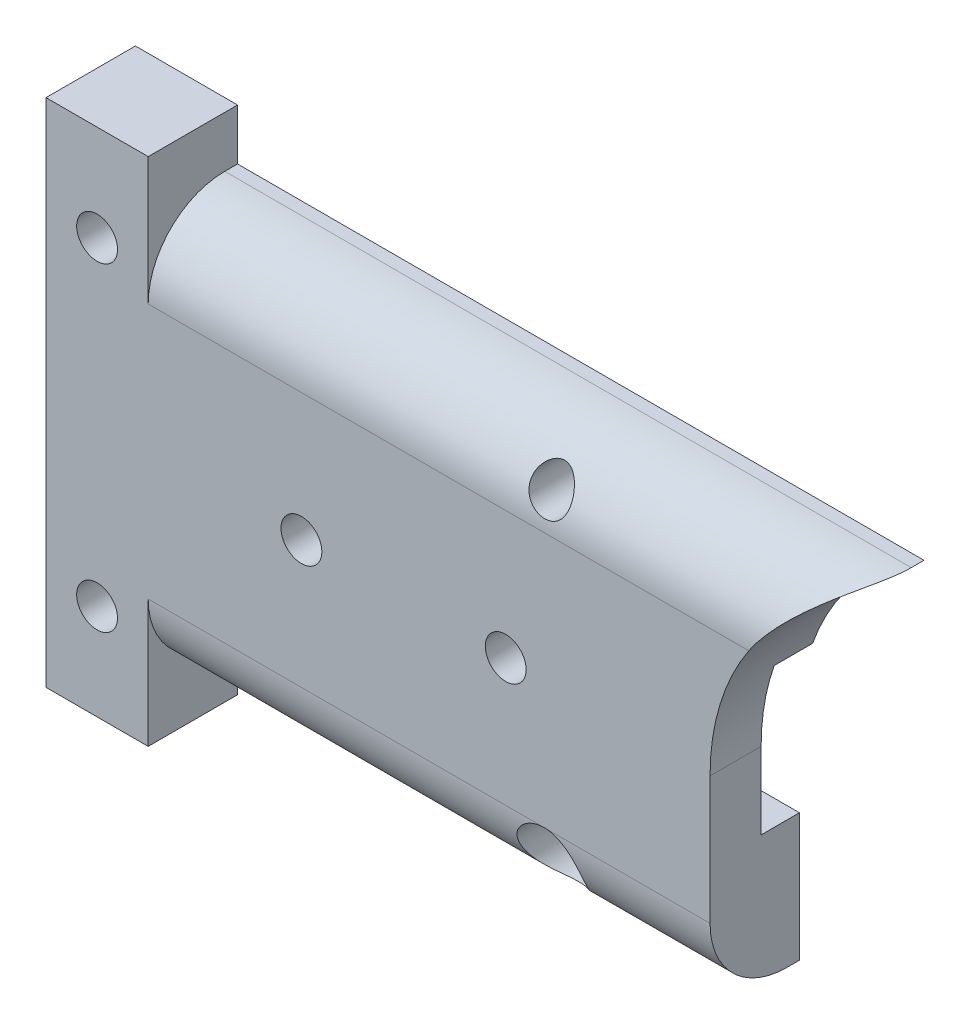
from build123d import *

# Parameters (mm, degrees)
SKETCH1_W           = 4
SKETCH1_H           = 2
BOSS_EXTRUDE1_DEPTH = 3.5
WIRE_CANAL_DEPTH    = 1.5
SKETCH2_R           = 0.8
SCREW_HOLES_DEPTH   = 43.383720665
FILLET1_START       = 14.161255893
FILLET1_DEPTH       = 27.838744107
CUT_EXTRUDE1_START  = 3.5
SKETCH4_R           = 1.25
CUT_EXTRUDE1_DEPTH  = 3


with BuildPart() as part:
    # Sketch1 → Boss-Extrude1 (new body)
    with BuildSketch(Plane.XY):
        with BuildLine():
            Line((10.161255893, 0), (36.161255894, 0))
            ThreePointArc((36.161255894, 0), (37.476597455, 4.684658438), (41.038150268, 8))
            Line((41.038150268, 8), (14.161255893, 8))
            Line((14.161255893, 8), (10.161255893, 8))
            Line((10.161255893, 8), (10.161255893, 0))
        make_face()
        Polygon((36.161255894, -8), (36.161255894, 0), (10.161255893, 0), (10.161255893, -8), (14.161255893, -8), align=None)
        with Locations((12.161255893, 9)):
            Rectangle(SKETCH1_W, SKETCH1_H)
        with Locations((12.161255893, -9)):
            Rectangle(SKETCH1_W, SKETCH1_H)
    extrude(amount=BOSS_EXTRUDE1_DEPTH)

    # Sketch3 → Wire Canal (cut)
    with BuildSketch(Plane.XY):
        Polygon((10.161255893, 3), (10.161255893, 0), (10.161255893, -3), (38.287392351, -3), (38.287392351, 3), align=None)
    extrude(amount=WIRE_CANAL_DEPTH, mode=Mode.SUBTRACT)

    # Sketch2 → Screw Holes (cut, through all)
    with BuildSketch(Plane.XY):
        with Locations(Location((20.161255894, 0, 0), (0, 0, 180))):
            Circle(SKETCH2_R)
        with Locations((12.161255894, -6.25)):
            Circle(SKETCH2_R)
        with Locations((29.661255894, 6.25)):
            Circle(SKETCH2_R)
        with Locations((29.661255894, -6.25)):
            Circle(SKETCH2_R)
        with Locations((12.161255894, 6.25)):
            Circle(SKETCH2_R)
        with Locations(Location((28.161255894, 0, 0), (0, 0, 180))):
            Circle(SKETCH2_R)
    extrude(amount=SCREW_HOLES_DEPTH, mode=Mode.SUBTRACT)

    # Fillet1: read off the stored shape, not the designer's step
    # Fillet1 outline → Fillet1 (cut)
    with BuildSketch(Plane.YZ.offset(FILLET1_START)):
        with BuildLine():
            Line((-8, 3.5), (-8, 0.5))
            ThreePointArc((-8, 0.5), (-7.121320344, 2.621320344), (-5, 3.5))
            Line((-5, 3.5), (-8, 3.5))
        make_face()
        with BuildLine():
            Line((8, 3.5), (5, 3.5))
            ThreePointArc((5, 3.5), (7.121320344, 2.621320344), (8, 0.5))
            Line((8, 0.5), (8, 3.5))
        make_face()
    extrude(amount=FILLET1_DEPTH, mode=Mode.SUBTRACT)

    # Sketch4 → Cut-Extrude1 (cut)
    with BuildSketch(Plane.XY.offset(CUT_EXTRUDE1_START)):
        with Locations((29.661255894, -6.25)):
            Circle(SKETCH4_R)
    extrude(amount=-CUT_EXTRUDE1_DEPTH, mode=Mode.SUBTRACT)


solid = part.part
